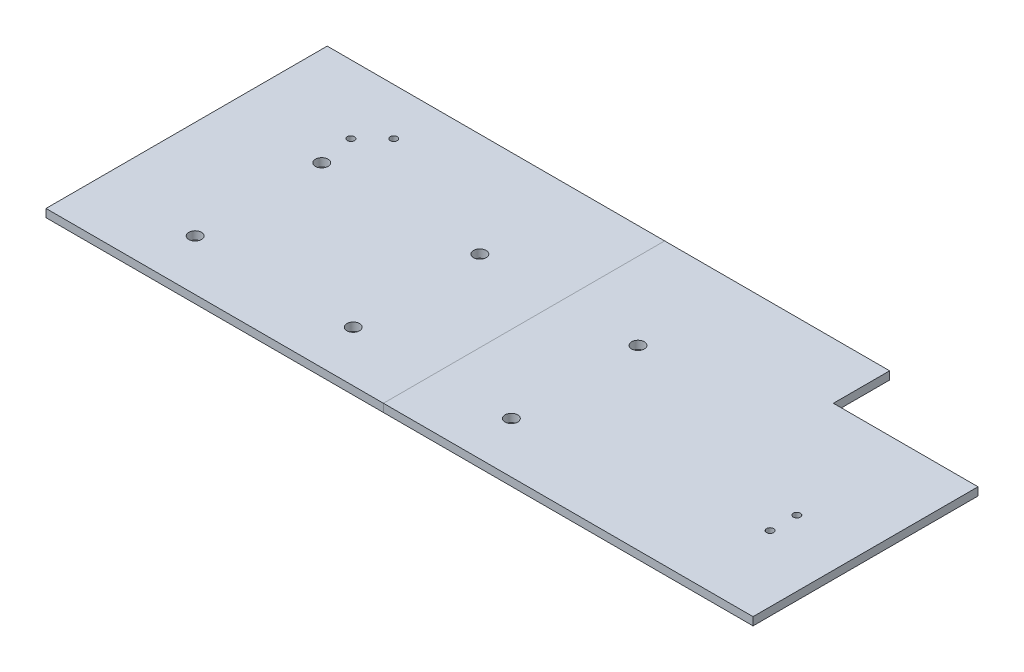
from build123d import *

# Parameters (mm, degrees)
BOSS_EXTRUDE1_DEPTH     = 6.35
CUT_EXTRUDE3_DEPTH      = 602.409033022
CUT_EXTRUDE3_DEPTH_BACK = 602.409033022
SKETCH10_R              = 5.0000027
SKETCH2_R               = 2.778125
CUT_EXTRUDE4_DEPTH      = 602.409033022
SPLIT1_SURFACE_1_BACK   = 602.409
SPLIT1_SURFACE_1_DEPTH  = 1204.818
SPLIT1_SURFACE_2_BACK   = 602.409
SPLIT1_SURFACE_2_DEPTH  = 1204.818


with BuildPart() as part:
    # Sketch1 → Boss-Extrude1 (new body)
    with BuildSketch(Plane(origin=(0, 0, 0), x_dir=(1, 0, 0), z_dir=(0, 1, 0))):
        Polygon((0, 0), (0, 177.8), (-114.3, 177.8), (-114.3, 222.25), (-558.8, 222.25), (-558.8, 0), align=None)
    extrude(amount=BOSS_EXTRUDE1_DEPTH)

    # Sketch10 → Cut-Extrude3 (cut, two sides: drawn at the far end of the back side and taken through both)
    with BuildSketch(Plane(origin=(0, 6.35, 0), x_dir=(1, 0, 0), z_dir=(0, 1, 0)).offset(-CUT_EXTRUDE3_DEPTH_BACK)):
        with Locations((-481.076, 40.132)):
            Circle(SKETCH10_R)
        with Locations((-356.108, 40.132)):
            Circle(SKETCH10_R)
        with Locations((-231.14, 40.132)):
            Circle(SKETCH10_R)
        with Locations((-356.108, 140.208)):
            Circle(SKETCH10_R)
        with Locations((-231.14, 140.208)):
            Circle(SKETCH10_R)
        with Locations((-481.076, 140.208)):
            Circle(SKETCH10_R)
    extrude(amount=CUT_EXTRUDE3_DEPTH + CUT_EXTRUDE3_DEPTH_BACK, mode=Mode.SUBTRACT)

    # Sketch2 → Cut-Extrude4 (cut, through all)
    with BuildSketch(Plane.XZ):
        with Locations((-52.1589, -86.783333333)):
            Circle(SKETCH2_R)
        with Locations((-52.1589, -65.616666667)):
            Circle(SKETCH2_R)
        with Locations((-469.142233333, -185.187166667)):
            Circle(SKETCH2_R)
        with Locations((-486.075566667, -168.253833333)):
            Circle(SKETCH2_R)
    extrude(amount=-CUT_EXTRUDE4_DEPTH, mode=Mode.SUBTRACT)


with BuildPart() as body_2:
    # Split1: the piece behind the surface
    add(part.part)
    # Split1 surface: a surface, the sketch's curves swept straight by 1204.818 mm
    with BuildLine(Plane(origin=(0, 6.35, 0), x_dir=(1, 0, 0), z_dir=(0, 1, 0)).offset(-SPLIT1_SURFACE_1_BACK), mode=Mode.PRIVATE) as split1_surface_1_path:
        Line((-292.1, 222.25), (-292.1, 0))
    split1_surface_1 = Shell.extrude(split1_surface_1_path.wire(), (0 * SPLIT1_SURFACE_1_DEPTH, 1 * SPLIT1_SURFACE_1_DEPTH, 0 * SPLIT1_SURFACE_1_DEPTH))
    split(bisect_by=split1_surface_1, keep=Keep.BOTTOM)


with BuildPart() as part_1:
    add(part.part)

    # Split1: split by a surface, the side it looks to stays
    # Split1 surface: a surface, the sketch's curves swept straight by 1204.818 mm
    with BuildLine(Plane(origin=(0, 6.35, 0), x_dir=(1, 0, 0), z_dir=(0, 1, 0)).offset(-SPLIT1_SURFACE_2_BACK), mode=Mode.PRIVATE) as split1_surface_2_path:
        Line((-292.1, 222.25), (-292.1, 0))
    split1_surface_2 = Shell.extrude(split1_surface_2_path.wire(), (0 * SPLIT1_SURFACE_2_DEPTH, 1 * SPLIT1_SURFACE_2_DEPTH, 0 * SPLIT1_SURFACE_2_DEPTH))
    split(bisect_by=split1_surface_2, keep=Keep.TOP)


solid = Compound([body_2.part, part_1.part])
